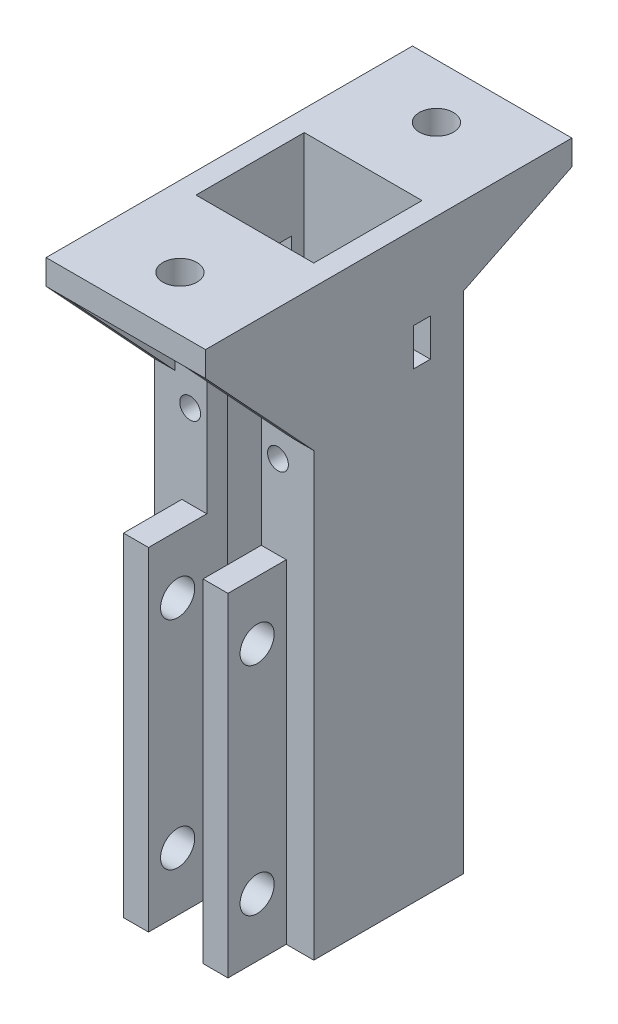
from build123d import *

# Parameters (mm, degrees)
BOSS_EXTRUDE1_DEPTH      = 40
SKETCH3_R                = 2.05
CUT_EXTRUDE2_DEPTH       = 40
BOSS_EXTRUDE11_DEPTH     = 30
SKETCH16_R               = 1.25
CUT_EXTRUDE9_DEPTH       = 3.5
SKETCH17_R               = 1.25
CUT_EXTRUDE10_DEPTH      = 3.5
SKETCH18_W               = 19.143059905
SKETCH18_H               = 3
BOSS_EXTRUDE4_DEPTH      = 15.5
BOSS_EXTRUDE5_DEPTH      = 13
BOSS_EXTRUDE5_DEPTH_BACK = 2
SKETCH19_W               = 19.143059905
SKETCH19_H               = 3
BOSS_EXTRUDE6_DEPTH      = 2.5
BOSS_EXTRUDE8_DEPTH      = 2.5
BOSS_EXTRUDE9_DEPTH      = 2.5
BOSS_EXTRUDE10_DEPTH     = 2.5
SKETCH25_R               = 2.05
CUT_EXTRUDE12_DEPTH      = 3.5
SKETCH27_W               = 2
SKETCH27_H               = 4.5
CUT_EXTRUDE13_DEPTH      = 79.023680411


with BuildPart() as part:
    # Sketch2 → Boss-Extrude1 (new body)
    with BuildSketch(Plane(origin=(0, 0, 0), x_dir=(1, 0, 0), z_dir=(0, 1, 0))):
        Polygon((-14.076483829, 2.342750264), (-14.076483829, -15.657249736), (-10.776483829, -15.657249736), (-10.776483829, -22.657249736), (-7.776483829, -22.657249736), (-7.776483829, -13.157249736), (-11.576483829, -13.157249736), (-11.576483829, -0.157249736), (2.566576076, -0.157249736), (2.566576076, -13.157249736), (-1.233423924, -13.157249736), (-1.233423924, -22.657249736), (1.766576076, -22.657249736), (1.766576076, -15.657249736), (5.066576076, -15.657249736), (5.066576076, 2.342750264), align=None)
    extrude(amount=BOSS_EXTRUDE1_DEPTH)

    # Sketch3 → Cut-Extrude2 (cut)
    with BuildSketch(Plane.ZY.offset(10.776483829)):
        with Locations((19.157249736, 33)):
            Circle(SKETCH3_R)
        with Locations((19.157249736, 7)):
            Circle(SKETCH3_R)
    extrude(amount=-CUT_EXTRUDE2_DEPTH, mode=Mode.SUBTRACT)

    # Sketch26 → Boss-Extrude11 (add)
    with BuildSketch(Plane(origin=(0, 40, 0), x_dir=(1, 0, 0), z_dir=(0, 1, 0))):
        Polygon((-1.233423924, -15.657249736), (1.766576076, -15.657249736), (5.066576076, -15.657249736), (5.066576076, 2.342750264), (-14.076483829, 2.342750264), (-14.076483829, -15.657249736), (-10.776483829, -15.657249736), (-7.776483829, -15.657249736), (-7.776483829, -13.157249736), (-11.576483829, -13.157249736), (-11.576483829, -0.157249736), (2.566576076, -0.157249736), (2.566576076, -13.157249736), (-1.233423924, -13.157249736), align=None)
    extrude(amount=BOSS_EXTRUDE11_DEPTH)

    # Sketch16 → Cut-Extrude9 (cut)
    with BuildSketch(Plane.XY.offset(15.657249736)):
        with Locations((-9.776483829, 50)):
            Circle(SKETCH16_R)
    extrude(amount=-CUT_EXTRUDE9_DEPTH, mode=Mode.SUBTRACT)

    # Sketch17 → Cut-Extrude10 (cut)
    with BuildSketch(Plane.XY.offset(15.657249736)):
        with Locations((0.766576076, 50)):
            Circle(SKETCH17_R)
    extrude(amount=-CUT_EXTRUDE10_DEPTH, mode=Mode.SUBTRACT)

    # Sketch18 → Boss-Extrude4 (add)
    with BuildSketch(Plane(origin=(0, 0, 13.157249736), x_dir=(-1, 0, 0), z_dir=(0, 0, -1))):
        with Locations((4.504953877, 68.5)):
            Rectangle(SKETCH18_W, SKETCH18_H)
    extrude(amount=-BOSS_EXTRUDE4_DEPTH)

    # Sketch19 → Boss-Extrude5 (add, two sides: drawn at the far end of the back side and taken through both)
    with BuildSketch(Plane(origin=(0, 0, -2.342750264), x_dir=(-1, 0, 0), z_dir=(0, 0, -1)).offset(-BOSS_EXTRUDE5_DEPTH_BACK)):
        with Locations((4.504953877, 68.5)):
            Rectangle(SKETCH19_W, SKETCH19_H)
    extrude(amount=BOSS_EXTRUDE5_DEPTH + BOSS_EXTRUDE5_DEPTH_BACK)

    # Sketch21 → Boss-Extrude6 (add)
    with BuildSketch(Plane.ZY.offset(14.076483829)):
        Polygon((28.657249736, 67), (15.657249736, 53), (15.657249736, 67), align=None)
    extrude(amount=-BOSS_EXTRUDE6_DEPTH)

    # Sketch22 → Boss-Extrude8 (add)
    with BuildSketch(Plane(origin=(5.066576076, 0, 0), x_dir=(0, 0, -1), z_dir=(1, 0, 0))):
        Polygon((-28.657249736, 67), (-15.657249736, 67), (-15.657249736, 53), align=None)
    extrude(amount=-BOSS_EXTRUDE8_DEPTH)

    # Sketch23 → Boss-Extrude9 (add)
    with BuildSketch(Plane(origin=(5.066576076, 0, 0), x_dir=(0, 0, -1), z_dir=(1, 0, 0))):
        Polygon((-13.157249736, 70), (-13.157249736, 53), (15.342750264, 67), (15.342750264, 70), align=None)
    extrude(amount=-BOSS_EXTRUDE9_DEPTH)

    # Sketch24 → Boss-Extrude10 (add)
    with BuildSketch(Plane.ZY.offset(14.076483829)):
        Polygon((13.157249736, 70), (-15.342750264, 70), (-15.342750264, 67), (13.157249736, 53), align=None)
    extrude(amount=-BOSS_EXTRUDE10_DEPTH)

    # Sketch25 → Cut-Extrude12 (cut)
    with BuildSketch(Plane(origin=(0, 70, 0), x_dir=(1, 0, 0), z_dir=(0, 1, 0))):
        with Locations((-4.704953829, 8.842750264)):
            Circle(SKETCH25_R)
        with Locations((-4.504953767, -22.157249736)):
            Circle(SKETCH25_R)
    extrude(amount=-CUT_EXTRUDE12_DEPTH, mode=Mode.SUBTRACT)

    # Sketch27 → Cut-Extrude13 (cut, through all)
    with BuildSketch(Plane(origin=(5.066576076, 0, 0), x_dir=(0, 0, -1), z_dir=(1, 0, 0))):
        with Locations((-2.657249736, 57.75)):
            Rectangle(SKETCH27_W, SKETCH27_H)
    extrude(amount=-CUT_EXTRUDE13_DEPTH, mode=Mode.SUBTRACT)


solid = part.part
